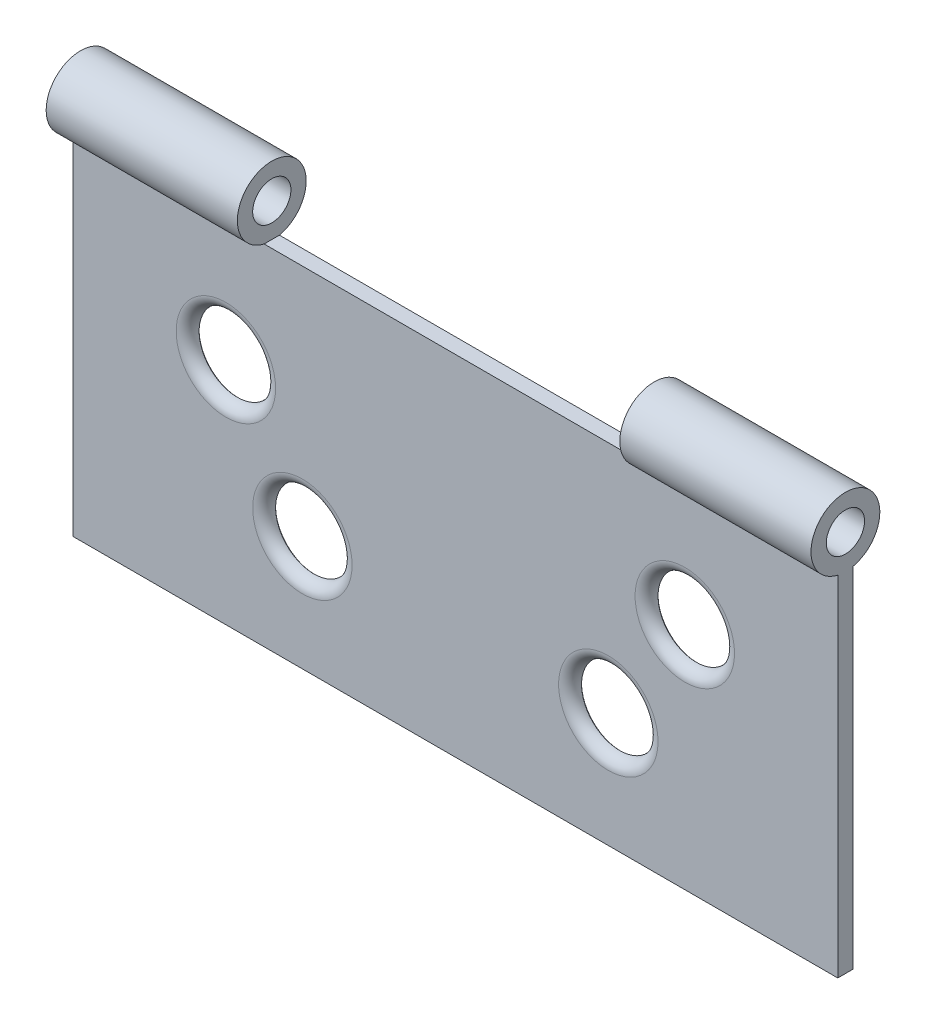
from build123d import *
from build123d.topology import SkipClean

# Parameters (mm, degrees)
ESBO_O1_W                  = 100
ESBO_O1_H                  = 50
ESBO_O1_R                  = 5
RESSALTO_EXTRUS_O1_DEPTH   = 2
FILETE1_R                  = 1.5
FILETE2_R                  = 1.5
ESBO_O2_R                  = 4.5
ESBO_O2_R_2                = 2.5
RESSALTO_EXTRUS_O2_DEPTH   = 100
CORTE_EXTRUS_O1_DEPTH      = 112.938599241
CORTE_EXTRUS_O2_DEPTH      = 10
CORTE_EXTRUS_O2_DEPTH_BACK = 112.938599241
ESBO_O4_W                  = 50
ESBO_O4_H                  = 20


with BuildPart() as part:
    # Esboço1 → Ressalto-extrusão1 (new body)
    with BuildSketch(Plane.XY):
        with Locations((-50, -25)):
            Rectangle(ESBO_O1_W, ESBO_O1_H)
        with Locations((-30, -35)):
            Circle(ESBO_O1_R, mode=Mode.SUBTRACT)
        with Locations((-80, -20)):
            Circle(ESBO_O1_R, mode=Mode.SUBTRACT)
        with Locations((-70, -35)):
            Circle(ESBO_O1_R, mode=Mode.SUBTRACT)
        with Locations((-20, -20)):
            Circle(ESBO_O1_R, mode=Mode.SUBTRACT)
    extrude(amount=RESSALTO_EXTRUS_O1_DEPTH)

    # Filete1
    filete1_edges = [part.edges().sort_by_distance(p)[0] for p in [
        (-75, -35, 2),
        (-85, -20, 2),
        (-35, -35, 2),
        (-25, -20, 2),
    ]]
    fillet(filete1_edges, radius=FILETE1_R)

    # Filete2
    # the kernel refuses this fillet: 1.5 mm, written as the material it takes off along each edge
    with BuildSketch(Plane(origin=(-30, -35, 0), x_dir=(1, 0, 0), z_dir=(0, -1, 0))) as filete2_piece_1:
        with BuildLine():
            CenterArc((6.118033989, 1.5), FILETE2_R, 221.810314896, 48.189685104)
            Line((6.118033989, 0), (6.118033989, -0.03))
            Line((6.118033989, -0.03), (5, -0.03))
            Line((5, -0.03), (4.97, 0))
            ThreePointArc((4.97, 0), (4.97, 0.25), (4.97763932, 0.48))
            Line((4.97763932, 0.48), (5, 0.5))
        make_face()
    revolve(axis=Axis((-30, -35, 0), (0, 0, 1)), mode=Mode.SUBTRACT)
    with BuildSketch(Plane(origin=(-80, -20, 0), x_dir=(1, 0, 0), z_dir=(0, -1, 0))) as filete2_piece_2:
        with BuildLine():
            CenterArc((6.118033989, 1.5), FILETE2_R, 221.810314896, 48.189685104)
            Line((5, 0.5), (4.97763932, 0.48))
            ThreePointArc((4.97763932, 0.48), (4.97, 0.25), (4.97, 0))
            Line((4.97, 0), (5, -0.03))
            Line((5, -0.03), (6.118033989, -0.03))
            Line((6.118033989, -0.03), (6.118033989, 0))
        make_face()
    revolve(axis=Axis((-80, -20, 0), (0, 0, 1)), mode=Mode.SUBTRACT)
    with BuildSketch(Plane(origin=(-70, -35, 0), x_dir=(1, 0, 0), z_dir=(0, -1, 0))) as filete2_piece_3:
        with BuildLine():
            CenterArc((6.118033989, 1.5), FILETE2_R, 221.810314896, 48.189685104)
            Line((5, 0.5), (4.97763932, 0.48))
            ThreePointArc((4.97763932, 0.48), (4.97, 0.25), (4.97, 0))
            Line((4.97, 0), (5, -0.03))
            Line((5, -0.03), (6.118033989, -0.03))
            Line((6.118033989, -0.03), (6.118033989, 0))
        make_face()
    revolve(axis=Axis((-70, -35, 0), (0, 0, 1)), mode=Mode.SUBTRACT)
    with BuildSketch(Plane(origin=(-20, -20, 0), x_dir=(1, 0, 0), z_dir=(0, -1, 0))) as filete2_piece_4:
        with BuildLine():
            CenterArc((6.118033989, 1.5), FILETE2_R, 221.810314896, 48.189685104)
            Line((5, 0.5), (4.97763932, 0.48))
            ThreePointArc((4.97763932, 0.48), (4.97, 0.25), (4.97, 0))
            Line((4.97, 0), (5, -0.03))
            Line((5, -0.03), (6.118033989, -0.03))
            Line((6.118033989, -0.03), (6.118033989, 0))
        make_face()
    revolve(axis=Axis((-20, -20, 0), (0, 0, 1)), mode=Mode.SUBTRACT)

    # Esboço2 → Ressalto-extrusão2 (add, through all)
    with BuildSketch(Plane(origin=(0, 0, 0), x_dir=(0, 0, -1), z_dir=(1, 0, 0))):
        with Locations((-1, 0)):
            Circle(ESBO_O2_R)
        with Locations((-1, 0)):
            Circle(ESBO_O2_R_2, mode=Mode.SUBTRACT)
    extrude(amount=-RESSALTO_EXTRUS_O2_DEPTH)

    # Esboço3 → Corte-extrusão1 (cut, through all)
    with SkipClean():  # the faces are left unmerged after this step: merging them gives an invalid solid
        with BuildSketch(Plane(origin=(0, 0, 0), x_dir=(0, 0, -1), z_dir=(1, 0, 0))):
            with BuildLine():
                Line((-2, 0), (-2, -2.291287847))
                ThreePointArc((-2, -2.291287847), (-1, 2.5), (0, -2.291287847))
                Line((0, -2.291287847), (0, 0))
                Line((0, 0), (-2, 0))
            make_face()
            with BuildLine():
                Line((0, 0), (0, -2.291287847))
                ThreePointArc((0, -2.291287847), (1.091650066, -1.369306394), (1.5, 0))
                ThreePointArc((1.5, 0), (-2.369306394, 2.091650066), (-2, -2.291287847))
                Line((-2, -2.291287847), (-2, 0))
                Line((-2, 0), (0, 0))
            make_face()
            with BuildLine():
                ThreePointArc((-2, -2.291287847), (-1, -2.5), (0, -2.291287847))
                Line((0, -2.291287847), (0, 0))
                Line((0, 0), (-2, 0))
                Line((-2, 0), (-2, -2.291287847))
            make_face()
        extrude(amount=-CORTE_EXTRUS_O1_DEPTH, mode=Mode.SUBTRACT)

    # Esboço4 → Corte-extrusão2 (cut, two sides: drawn at the far end of the back side and taken through both)
    with BuildSketch(Plane(origin=(0, 0, 0), x_dir=(-1, 0, 0), z_dir=(0, 0, -1)).offset(-CORTE_EXTRUS_O2_DEPTH_BACK)):
        with Locations((50, 5.612517806)):
            Rectangle(ESBO_O4_W, ESBO_O4_H)
    extrude(amount=CORTE_EXTRUS_O2_DEPTH + CORTE_EXTRUS_O2_DEPTH_BACK, mode=Mode.SUBTRACT)


solid = part.part
